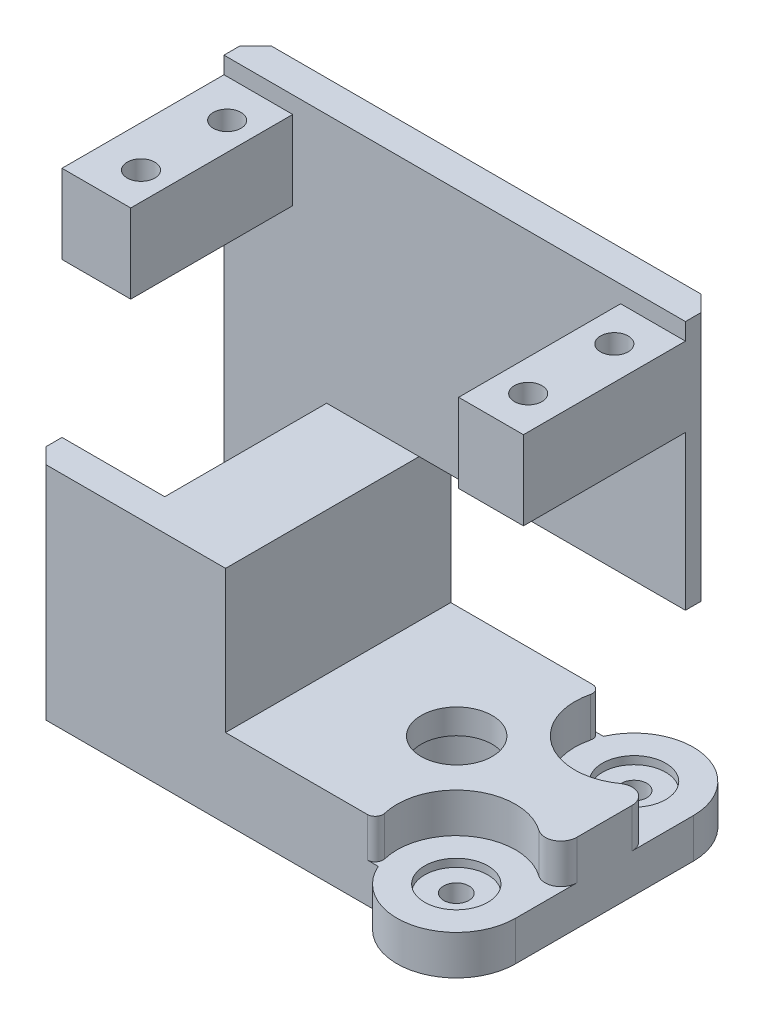
from build123d import *

# Parameters (mm, degrees)
SZKIC1_R                    = 4.5
DODANIE_WYCI_GNI_CIE1_DEPTH = 10
SZKIC3_R                    = 6.5
WYTNIJ_WYCI_GNI_CIE9_DEPTH  = 6.85
DODANIE_WYCI_GNI_CIE2_DEPTH = 18
DODANIE_WYCI_GNI_CIE3_DEPTH = 31.65
DODANIE_WYCI_GNI_CIE4_DEPTH = 20.5
WYTNIJ_WYCI_GNI_CIE3_REACH  = 73.312
SZKIC8_R                    = 1.7500000000000036
SZKIC8_R_2                  = 1.7499999999999982
SFAZOWANIE1_SIZE            = 2
DODANIE_WYCI_GNI_CIE5_DEPTH = 10
WYTNIJ_WYCI_GNI_CIE4_REACH  = 76.066
SZKIC12_R                   = 1.6000000000000019
WYTNIJ_WYCI_GNI_CIE6_START  = -5
SZKIC14_R                   = 7.499999999999999
WYTNIJ_WYCI_GNI_CIE6_DEPTH  = 5
SZKIC13_R                   = 4.000000000000001
WYTNIJ_WYCI_GNI_CIE5_DEPTH  = 1
ZAOKR_GLENIE1_R             = 2
ZAOKR_GLENIE2_R             = 1
WYTNIJ_WYCI_GNI_CIE7_DEPTH  = 13
WYTNIJ_WYCI_GNI_CIE8_REACH  = 71.325
SZKIC16_R                   = 1.599999999999998


with BuildPart() as part:
    # Szkic1 → Dodanie-wyciągnięcie1 (new body)
    with BuildSketch(Plane(origin=(0, 0, 0), x_dir=(1, 0, 0), z_dir=(0, 1, 0))):
        Polygon((-39.699999999999996, 14.25), (11.950000000000069, 14.25), (18.7, 7.5), (18.7, -7.5), (11.95000000000007, -14.25), (-39.699999999999996, -14.25), align=None)
        with Locations(Location((0, 0, 0), (0, 0, 270))):
            Circle(SZKIC1_R, mode=Mode.SUBTRACT)
    extrude(amount=DODANIE_WYCI_GNI_CIE1_DEPTH)

    # Szkic3 → Wytnij-wyciągnięcie9 (cut)
    with BuildSketch(Plane.XZ):
        with Locations(Location((0, 0, 0), (0, 0, 270))):
            Circle(SZKIC3_R)
    extrude(amount=-WYTNIJ_WYCI_GNI_CIE9_DEPTH, mode=Mode.SUBTRACT)

    # Szkic4 → Dodanie-wyciągnięcie2 (add)
    with BuildSketch(Plane(origin=(0, 10, 0), x_dir=(1, 0, 0), z_dir=(0, 1, 0))):
        Polygon((-39.699999999999996, 14.25), (-15, 14.25), (-14.999999999999996, -14.25), (-39.699999999999996, -14.25), align=None)
    extrude(amount=DODANIE_WYCI_GNI_CIE2_DEPTH)

    # Szkic6 → Dodanie-wyciągnięcie3 (add)
    with BuildSketch(Plane(origin=(0, 27.999999999999996, 0), x_dir=(1, 0, 0), z_dir=(0, 1, 0))):
        Polygon((-39.699999999999996, 14.25), (18.699999999999996, 14.25), (18.7, 10.25), (-39.699999999999996, 10.25), align=None)
    extrude(amount=DODANIE_WYCI_GNI_CIE3_DEPTH)

    # Szkic7 → Dodanie-wyciągnięcie4 (add)
    with BuildSketch(Plane.XY.offset(-10.25)):
        Polygon((18.7, 57.49999999999999), (10.499999999999995, 57.49999999999999), (10.499999999999996, 47.49999999999999), (18.7, 47.49999999999999), align=None)
        Polygon((-39.699999999999996, 57.499999999999986), (-31.000000000000007, 57.499999999999986), (-31.000000000000004, 47.499999999999986), (-39.699999999999996, 47.499999999999986), align=None)
    extrude(amount=DODANIE_WYCI_GNI_CIE4_DEPTH)

    # Szkic8 → Wytnij-wyciągnięcie3 (cut, up to next)
    with BuildSketch(Plane(origin=(0, 57.499999999999986, 0), x_dir=(1, 0, 0), z_dir=(0, 1, 0)), mode=Mode.PRIVATE) as wytnij_wyci_gni_cie3_sk1:
        with Locations(Location((-34.5, 5.450000000000001, 0), (0, 0, 270))):
            Circle(SZKIC8_R)
    wytnij_wyci_gni_cie3_tool1 = extrude(wytnij_wyci_gni_cie3_sk1.sketch, amount=-WYTNIJ_WYCI_GNI_CIE3_REACH, mode=Mode.PRIVATE) & part.part
    # Szkic8 → Wytnij-wyciągnięcie3 (cut, up to next)
    with BuildSketch(Plane(origin=(0, 57.499999999999986, 0), x_dir=(1, 0, 0), z_dir=(0, 1, 0)), mode=Mode.PRIVATE) as wytnij_wyci_gni_cie3_sk2:
        with Locations(Location((14.5, 5.450000000000002, 0), (0, 0, 270))):
            Circle(SZKIC8_R_2)
    wytnij_wyci_gni_cie3_tool2 = extrude(wytnij_wyci_gni_cie3_sk2.sketch, amount=-WYTNIJ_WYCI_GNI_CIE3_REACH, mode=Mode.PRIVATE) & part.part
    # Szkic8 → Wytnij-wyciągnięcie3 (cut, up to next)
    with BuildSketch(Plane(origin=(0, 57.499999999999986, 0), x_dir=(1, 0, 0), z_dir=(0, 1, 0)), mode=Mode.PRIVATE) as wytnij_wyci_gni_cie3_sk3:
        with Locations(Location((14.5, -5.450000000000002, 0), (0, 0, 270))):
            Circle(SZKIC8_R_2)
    wytnij_wyci_gni_cie3_tool3 = extrude(wytnij_wyci_gni_cie3_sk3.sketch, amount=-WYTNIJ_WYCI_GNI_CIE3_REACH, mode=Mode.PRIVATE) & part.part
    # Szkic8 → Wytnij-wyciągnięcie3 (cut, up to next)
    with BuildSketch(Plane(origin=(0, 57.499999999999986, 0), x_dir=(1, 0, 0), z_dir=(0, 1, 0)), mode=Mode.PRIVATE) as wytnij_wyci_gni_cie3_sk4:
        with Locations(Location((-34.5, -5.450000000000001, 0), (0, 0, 270))):
            Circle(SZKIC8_R)
    wytnij_wyci_gni_cie3_tool4 = extrude(wytnij_wyci_gni_cie3_sk4.sketch, amount=-WYTNIJ_WYCI_GNI_CIE3_REACH, mode=Mode.PRIVATE) & part.part
    add(wytnij_wyci_gni_cie3_tool1.solids().sort_by_distance((-34.5, 57.5, -5.45))[0], mode=Mode.SUBTRACT)
    add(wytnij_wyci_gni_cie3_tool2.solids().sort_by_distance((14.5, 57.5, -5.45))[0], mode=Mode.SUBTRACT)
    add(wytnij_wyci_gni_cie3_tool3.solids().sort_by_distance((14.5, 57.5, 5.45))[0], mode=Mode.SUBTRACT)
    add(wytnij_wyci_gni_cie3_tool4.solids().sort_by_distance((-34.5, 57.5, 5.45))[0], mode=Mode.SUBTRACT)

    # Sfazowanie1
    sfazowanie1_edges = [part.edges().sort_by_distance(p)[0] for p in [
        (-39.699999999999996, 29.824999999999996, -14.25),
        (-39.699999999999996, 14, 14.25),
        (18.699999999999996, 43.824999999999996, -14.25),
    ]]
    chamfer(sfazowanie1_edges, length=SFAZOWANIE1_SIZE)

    # Szkic9 → Dodanie-wyciągnięcie5 (add)
    with BuildSketch(Plane.XZ):
        with BuildLine():
            Line((18.7, -7.5), (11.950000000000069, -14.25))
            Line((11.950000000000069, -14.25), (4.326136457566238, -14.249999999999998))
            ThreePointArc((4.326136457566238, -14.249999999999998), (12.732322327669147, -18.59179734698027), (18.7, -11.25))
            Line((18.7, -11.25), (18.7, -7.5))
        make_face()
        with BuildLine():
            Line((18.7, 7.5), (18.7, 11.25))
            ThreePointArc((18.7, 11.25), (12.732322327669147, 18.59179734698027), (4.326136457566238, 14.249999999999998))
            Line((4.326136457566238, 14.249999999999998), (11.950000000000069, 14.25))
            Line((11.950000000000069, 14.25), (18.7, 7.5))
        make_face()
    extrude(amount=-DODANIE_WYCI_GNI_CIE5_DEPTH)

    # Szkic12 → Wytnij-wyciągnięcie4 (cut, up to next)
    with BuildSketch(Plane.XZ, mode=Mode.PRIVATE) as wytnij_wyci_gni_cie4_sk1:
        with Locations(Location((11.199999999999998, -11.25, 0), (0, 0, 270))):
            Circle(SZKIC12_R)
    wytnij_wyci_gni_cie4_tool1 = extrude(wytnij_wyci_gni_cie4_sk1.sketch, amount=-WYTNIJ_WYCI_GNI_CIE4_REACH, mode=Mode.PRIVATE) & part.part
    # Szkic12 → Wytnij-wyciągnięcie4 (cut, up to next)
    with BuildSketch(Plane.XZ, mode=Mode.PRIVATE) as wytnij_wyci_gni_cie4_sk2:
        with Locations(Location((11.199999999999998, 11.25, 0), (0, 0, 90))):
            Circle(SZKIC12_R)
    wytnij_wyci_gni_cie4_tool2 = extrude(wytnij_wyci_gni_cie4_sk2.sketch, amount=-WYTNIJ_WYCI_GNI_CIE4_REACH, mode=Mode.PRIVATE) & part.part
    add(wytnij_wyci_gni_cie4_tool1.solids().sort_by_distance((11.2, 0, -11.25))[0], mode=Mode.SUBTRACT)
    add(wytnij_wyci_gni_cie4_tool2.solids().sort_by_distance((11.2, 0, 11.25))[0], mode=Mode.SUBTRACT)

    # Szkic14 → Wytnij-wyciągnięcie6 (cut)
    with BuildSketch(Plane(origin=(0, 10, 0), x_dir=(1, 0, 0), z_dir=(0, 1, 0)).offset(WYTNIJ_WYCI_GNI_CIE6_START)):
        with Locations((11.199999999999998, -11.25)):
            Circle(SZKIC14_R)
        with Locations((11.199999999999998, 11.25)):
            Circle(SZKIC14_R)
    extrude(amount=WYTNIJ_WYCI_GNI_CIE6_DEPTH, mode=Mode.SUBTRACT)

    # Szkic13 → Wytnij-wyciągnięcie5 (cut)
    with BuildSketch(Plane(origin=(0, 5, 0), x_dir=(1, 0, 0), z_dir=(0, 1, 0))):
        with Locations(Location((11.199999999999998, 11.25, 0), (0, 0, 270))):
            Circle(SZKIC13_R)
        with Locations(Location((11.199999999999998, -11.25, 0), (0, 0, 90))):
            Circle(SZKIC13_R)
    extrude(amount=-WYTNIJ_WYCI_GNI_CIE5_DEPTH, mode=Mode.SUBTRACT)

    # Zaokrąglenie1
    zaokr_glenie1_edges = [part.edges().sort_by_distance(p)[0] for p in [
        (18.700000000000003, 7.5, 11.25),
        (18.7, 7.5, -11.25),
    ]]
    fillet(zaokr_glenie1_edges, radius=ZAOKR_GLENIE1_R - 0.0001)  # a hair under: the kernel refuses the full size

    # Zaokrąglenie2
    zaokr_glenie2_edges = [part.edges().sort_by_distance(p)[0] for p in [
        (4.326136457566238, 7.5, 14.25),
        (4.326136457566238, 7.5, -14.249999999999998),
    ]]
    fillet(zaokr_glenie2_edges, radius=ZAOKR_GLENIE2_R)

    # Szkic15 → Wytnij-wyciągnięcie7 (cut)
    with BuildSketch(Plane.ZY.offset(39.699999999999996)):
        Polygon((-10.25, 27.999999999999996), (10.25, 27.999999999999996), (10.250000000000002, 6), (-10.25, 6), align=None)
    extrude(amount=-WYTNIJ_WYCI_GNI_CIE7_DEPTH, mode=Mode.SUBTRACT)

    # Szkic16 → Wytnij-wyciągnięcie8 (cut, up to next)
    with BuildSketch(Plane(origin=(0, 6, 0), x_dir=(1, 0, 0), z_dir=(0, 1, 0)), mode=Mode.PRIVATE) as wytnij_wyci_gni_cie8_sk1:
        with Locations(Location((-33.2, 0, 0), (0, 0, 270))):
            Circle(SZKIC16_R)
    wytnij_wyci_gni_cie8_tool1 = extrude(wytnij_wyci_gni_cie8_sk1.sketch, amount=-WYTNIJ_WYCI_GNI_CIE8_REACH, mode=Mode.PRIVATE) & part.part
    add(wytnij_wyci_gni_cie8_tool1.solids().sort_by_distance((-33.2, 6, 0))[0], mode=Mode.SUBTRACT)


solid = part.part
